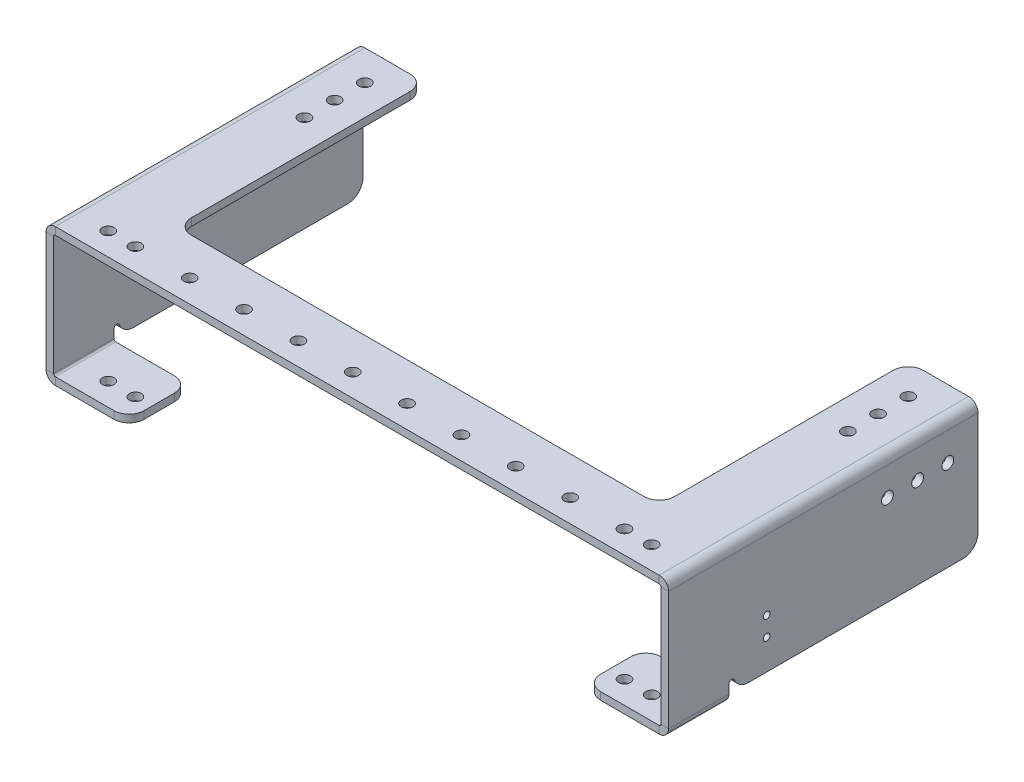
from build123d import *

# Parameters (mm, degrees)
SKETCH2_R               = 2.4892
BOSS_EXTRUDE1_DEPTH     = 3.175
SKETCH3_R               = 2.4892
CUT_EXTRUDE1_DEPTH      = 143.74264703
EDGE_FLANGE1_DEPTH      = 130.175
EDGE_FLANGE1_BEND_DEPTH = 130.175
CUT_EXTRUDE2_DEPTH      = 275.581526204
EDGE_FLANGE2_DEPTH      = 25.4
EDGE_FLANGE2_BEND_DEPTH = 25.4
CUT_EXTRUDE3_REACH      = 159.273
SKETCH22_R              = 2.4892
FILLET2_R               = 6.35
SKETCH23_R              = 2.4892
CUT_EXTRUDE4_DEPTH      = 276.337091157
CUT_EXTRUDE5_REACH      = 277.337
SKETCH24_R              = 1.42494


# Sheet-metal steps are written as plain solids
with BuildPart() as part:
    # Sketch2 → Boss-Extrude1 (new body)
    with BuildSketch(Plane(origin=(0, 0, 0), x_dir=(1, 0, 0), z_dir=(0, 1, 0))):
        Polygon((-127, 65.0875), (-127, -65.0875), (127, -65.0875), (127, 65.0875), (101.6, 65.0875), (101.6, -39.624), (-101.6, -39.624), (-101.6, 65.0875), align=None)
        with Locations(Location((-114.3, 26.9875, 0), (0, 0, 270))):
            Circle(SKETCH2_R, mode=Mode.SUBTRACT)
        with Locations(Location((-114.3, 39.6875, 0), (0, 0, 270))):
            Circle(SKETCH2_R, mode=Mode.SUBTRACT)
        with Locations(Location((-114.3, 52.3875, 0), (0, 0, 270))):
            Circle(SKETCH2_R, mode=Mode.SUBTRACT)
        with Locations(Location((114.3, 26.9875, 0), (0, 0, 270))):
            Circle(SKETCH2_R, mode=Mode.SUBTRACT)
        with Locations(Location((114.3, 39.6875, 0), (0, 0, 270))):
            Circle(SKETCH2_R, mode=Mode.SUBTRACT)
        with Locations(Location((114.3, 52.3875, 0), (0, 0, 270))):
            Circle(SKETCH2_R, mode=Mode.SUBTRACT)
    extrude(amount=BOSS_EXTRUDE1_DEPTH)

    # Sketch3 → Cut-Extrude1 (cut, through all)
    with BuildSketch(Plane(origin=(0, 3.175, 0), x_dir=(1, 0, 0), z_dir=(0, 1, 0))):
        with Locations(Location((-102.87, -55.5625, 0), (0, 0, 270))):
            Circle(SKETCH3_R)
        with Locations(Location((-80.01, -55.5625, 0), (0, 0, 270))):
            Circle(SKETCH3_R)
        with Locations(Location((-114.3, -55.5625, 0), (0, 0, 270))):
            Circle(SKETCH3_R)
        with Locations(Location((-57.15, -55.5625, 0), (0, 0, 270))):
            Circle(SKETCH3_R)
        with Locations(Location((114.3, -55.5625, 0), (0, 0, 270))):
            Circle(SKETCH3_R)
        with Locations(Location((-34.29, -55.5625, 0), (0, 0, 270))):
            Circle(SKETCH3_R)
        with Locations(Location((-11.43, -55.5625, 0), (0, 0, 270))):
            Circle(SKETCH3_R)
        with Locations(Location((11.43, -55.5625, 0), (0, 0, 270))):
            Circle(SKETCH3_R)
        with Locations(Location((34.29, -55.5625, 0), (0, 0, 270))):
            Circle(SKETCH3_R)
        with Locations(Location((57.15, -55.5625, 0), (0, 0, 270))):
            Circle(SKETCH3_R)
        with Locations(Location((80.01, -55.5625, 0), (0, 0, 270))):
            Circle(SKETCH3_R)
        with Locations(Location((102.87, -55.5625, 0), (0, 0, 270))):
            Circle(SKETCH3_R)
    extrude(amount=-CUT_EXTRUDE1_DEPTH, mode=Mode.SUBTRACT)

    # Edge-Flange1 section (across the edge) → Edge-Flange1 (add)
    with BuildSketch(Plane(origin=(127.762, 0, -65.0875), x_dir=(-1, 0, 0), z_dir=(0, 0, 1))):
        with BuildLine():
            Line((-3.175, 0.762), (-3.175, 50.8))
            Line((-3.175, 50.8), (0, 50.8))
            Line((0, 50.8), (0, 0.762))
            ThreePointArc((0, 0.762), (0.223184633, 0.223184633), (0.762, 0))
            Line((0.762, 0), (0.762, -3.175))
            ThreePointArc((0.762, -3.175), (-2.021879398, -2.021879398), (-3.175, 0.762))
        make_face()
    extrude(amount=EDGE_FLANGE1_DEPTH)

    # Edge-Flange1 section 2 (across the edge) → Edge-Flange1 bend (add)
    with BuildSketch(Plane(origin=(-127.762, 0, 65.0875), x_dir=(1, 0, 0), z_dir=(0, 0, -1))):
        with BuildLine():
            Line((-3.175, 0.762), (-3.175, 50.8))
            Line((-3.175, 50.8), (0, 50.8))
            Line((0, 50.8), (0, 0.762))
            ThreePointArc((0, 0.762), (0.223184633, 0.223184633), (0.762, 0))
            Line((0.762, 0), (0.762, -3.175))
            ThreePointArc((0.762, -3.175), (-2.021879398, -2.021879398), (-3.175, 0.762))
        make_face()
    extrude(amount=EDGE_FLANGE1_BEND_DEPTH)

    # Sketch15 → Cut-Extrude2 (cut, through all)
    with BuildSketch(Plane(origin=(130.937, 0, 0), x_dir=(0, 0, -1), z_dir=(1, 0, 0))):
        with BuildLine():
            Line((-39.6875, -47.228125), (-39.6875, -50.8))
            Line((-39.6875, -50.8), (-37.30625, -50.8))
            Line((-37.30625, -50.8), (-37.30625, -47.228125))
            ThreePointArc((-37.30625, -47.228125), (-37.654975989, -46.386225989), (-38.496875, -46.0375))
            ThreePointArc((-38.496875, -46.0375), (-39.338774011, -46.386225989), (-39.6875, -47.228125))
        make_face()
    extrude(amount=-CUT_EXTRUDE2_DEPTH, mode=Mode.SUBTRACT)

    # Edge-Flange2 section (across the edge) → Edge-Flange2 (add)
    with BuildSketch(Plane(origin=(127.762, -51.562, 39.6875), x_dir=(0, 1, 0), z_dir=(0, 0, 1))):
        with BuildLine():
            Line((-3.175, 0.762), (-3.175, 31.75))
            Line((-3.175, 31.75), (0, 31.75))
            Line((0, 31.75), (0, 0.762))
            ThreePointArc((0, 0.762), (0.223184633, 0.223184633), (0.762, 0))
            Line((0.762, 0), (0.762, -3.175))
            ThreePointArc((0.762, -3.175), (-2.021879398, -2.021879398), (-3.175, 0.762))
        make_face()
    extrude(amount=EDGE_FLANGE2_DEPTH)

    # Edge-Flange2 section 2 (across the edge) → Edge-Flange2 bend (add)
    with BuildSketch(Plane(origin=(-127.762, -51.562, 65.0875), x_dir=(0, 1, 0), z_dir=(0, 0, -1))):
        with BuildLine():
            Line((-3.175, 0.762), (-3.175, 31.75))
            Line((-3.175, 31.75), (0, 31.75))
            Line((0, 31.75), (0, 0.762))
            ThreePointArc((0, 0.762), (0.223184633, 0.223184633), (0.762, 0))
            Line((0.762, 0), (0.762, -3.175))
            ThreePointArc((0.762, -3.175), (-2.021879398, -2.021879398), (-3.175, 0.762))
        make_face()
    extrude(amount=EDGE_FLANGE2_BEND_DEPTH)

    # Sketch22 → Cut-Extrude3 (cut, up to next)
    with BuildSketch(Plane.XZ.offset(54.737), mode=Mode.PRIVATE) as cut_extrude3_sk1:
        with Locations(Location((-102.87, 55.5625, 0), (0, 0, 90))):
            Circle(SKETCH22_R)
    cut_extrude3_tool1 = extrude(cut_extrude3_sk1.sketch, amount=-CUT_EXTRUDE3_REACH, mode=Mode.PRIVATE) & part.part
    # Sketch22 → Cut-Extrude3 (cut, up to next)
    with BuildSketch(Plane.XZ.offset(54.737), mode=Mode.PRIVATE) as cut_extrude3_sk2:
        with Locations(Location((-114.3, 55.5625, 0), (0, 0, 90))):
            Circle(SKETCH22_R)
    cut_extrude3_tool2 = extrude(cut_extrude3_sk2.sketch, amount=-CUT_EXTRUDE3_REACH, mode=Mode.PRIVATE) & part.part
    # Sketch22 → Cut-Extrude3 (cut, up to next)
    with BuildSketch(Plane.XZ.offset(54.737), mode=Mode.PRIVATE) as cut_extrude3_sk3:
        with Locations(Location((102.87, 55.5625, 0), (0, 0, 90))):
            Circle(SKETCH22_R)
    cut_extrude3_tool3 = extrude(cut_extrude3_sk3.sketch, amount=-CUT_EXTRUDE3_REACH, mode=Mode.PRIVATE) & part.part
    # Sketch22 → Cut-Extrude3 (cut, up to next)
    with BuildSketch(Plane.XZ.offset(54.737), mode=Mode.PRIVATE) as cut_extrude3_sk4:
        with Locations(Location((114.3, 55.5625, 0), (0, 0, 90))):
            Circle(SKETCH22_R)
    cut_extrude3_tool4 = extrude(cut_extrude3_sk4.sketch, amount=-CUT_EXTRUDE3_REACH, mode=Mode.PRIVATE) & part.part
    add(cut_extrude3_tool1.solids().sort_by_distance((-102.87, -54.737, 55.5625))[0], mode=Mode.SUBTRACT)
    add(cut_extrude3_tool2.solids().sort_by_distance((-114.3, -54.737, 55.5625))[0], mode=Mode.SUBTRACT)
    add(cut_extrude3_tool3.solids().sort_by_distance((102.87, -54.737, 55.5625))[0], mode=Mode.SUBTRACT)
    add(cut_extrude3_tool4.solids().sort_by_distance((114.3, -54.737, 55.5625))[0], mode=Mode.SUBTRACT)

    # Fillet2
    fillet2_edges = [part.edges().sort_by_distance(p)[0] for p in [
        (96.012, -53.1495, 65.0875),
        (96.012, -53.1495, 39.6875),
        (129.3495, -50.8, -65.0875),
        (101.6, 1.5875, -65.0875),
        (101.6, 1.5875, 39.624),
        (-101.6, 1.5875, 39.624),
        (-101.6, 1.5875, -65.0875),
        (-129.3495, -50.8, -65.0875),
        (-96.012, -53.1495, 65.0875),
        (-96.012, -53.1495, 39.6875),
        (129.3495, -50.8, 37.30625),
        (-129.3495, -50.8, 37.30625),
    ]]
    fillet(fillet2_edges, radius=FILLET2_R)

    # Sketch23 → Cut-Extrude4 (cut, through all)
    with BuildSketch(Plane(origin=(130.937, 0, 0), x_dir=(0, 0, -1), z_dir=(1, 0, 0))):
        with Locations(Location((52.3875, -12.7, 0), (0, 0, 90))):
            Circle(SKETCH23_R)
        with Locations(Location((39.6875, -12.7, 0), (0, 0, 90))):
            Circle(SKETCH23_R)
        with Locations(Location((26.9875, -12.7, 0), (0, 0, 90))):
            Circle(SKETCH23_R)
    extrude(amount=-CUT_EXTRUDE4_DEPTH, mode=Mode.SUBTRACT)

    # Sketch24 → Cut-Extrude5 (cut, up to next)
    with BuildSketch(Plane(origin=(130.937, 0, 0), x_dir=(0, 0, -1), z_dir=(1, 0, 0)), mode=Mode.PRIVATE) as cut_extrude5_sk1:
        with Locations(Location((-23.8125, -38.1, 0), (0, 0, 90))):
            Circle(SKETCH24_R)
    cut_extrude5_tool1 = extrude(cut_extrude5_sk1.sketch, amount=-CUT_EXTRUDE5_REACH, mode=Mode.PRIVATE) & part.part
    # Sketch24 → Cut-Extrude5 (cut, up to next)
    with BuildSketch(Plane(origin=(130.937, 0, 0), x_dir=(0, 0, -1), z_dir=(1, 0, 0)), mode=Mode.PRIVATE) as cut_extrude5_sk2:
        with Locations(Location((-23.8125, -30.099999998, 0), (0, 0, 90))):
            Circle(SKETCH24_R)
    cut_extrude5_tool2 = extrude(cut_extrude5_sk2.sketch, amount=-CUT_EXTRUDE5_REACH, mode=Mode.PRIVATE) & part.part
    add(cut_extrude5_tool1.solids().sort_by_distance((130.937, -38.1, 23.8125))[0], mode=Mode.SUBTRACT)
    add(cut_extrude5_tool2.solids().sort_by_distance((130.937, -30.1, 23.8125))[0], mode=Mode.SUBTRACT)


solid = part.part
